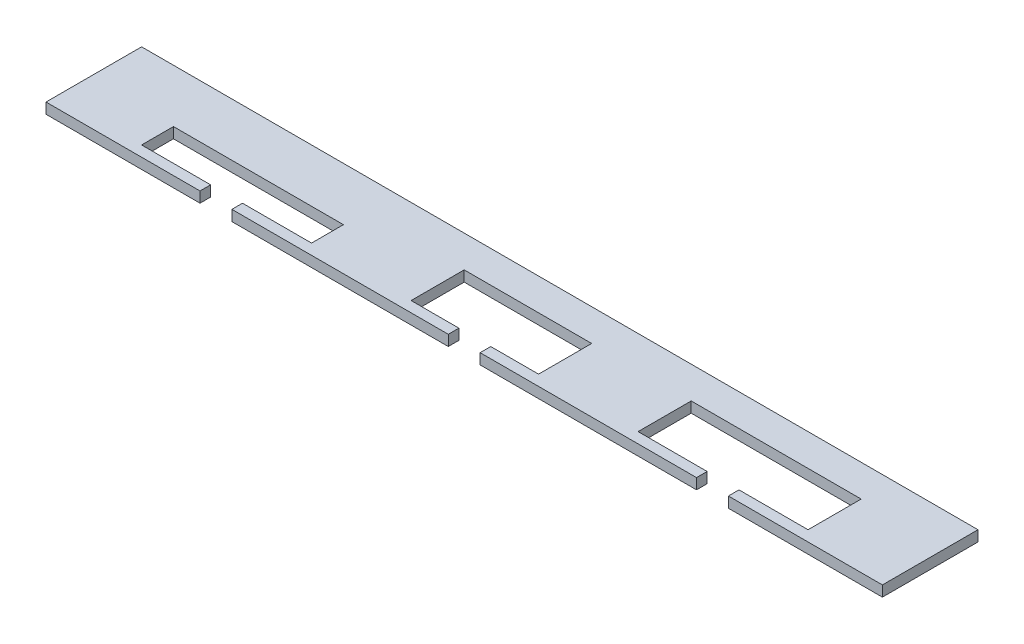
from build123d import *

# Parameters (mm, degrees)
BOSS_EXTRUDE1_DEPTH = 12.7


with BuildPart() as part:
    # Sketch1 → Boss-Extrude1 (new body)
    with BuildSketch(Plane(origin=(0, 0, 0), x_dir=(1, 0, 0), z_dir=(0, 1, 0))):
        Polygon((0, 0), (0, 114.3), (1000.00054, 114.3), (1000.00054, 0), (815.85054, 0), (815.85054, 12.7), (898.40054, 12.7), (898.40054, 76.2), (695.20054, 76.2), (695.20054, 12.7), (777.75054, 12.7), (777.75054, 0), (550.80027, 0), (519.05027, 0), (519.05027, 12.7), (576.20027, 12.7), (576.20027, 76.2), (423.80027, 76.2), (423.80027, 12.7), (480.95027, 12.7), (480.95027, 0), (449.20027, 0), (222.25, 0), (222.25, 12.7), (304.8, 12.7), (304.8, 50.8), (101.6, 50.8), (101.6, 12.7), (184.15, 12.7), (184.15, 0), align=None)
    extrude(amount=BOSS_EXTRUDE1_DEPTH)


solid = part.part
